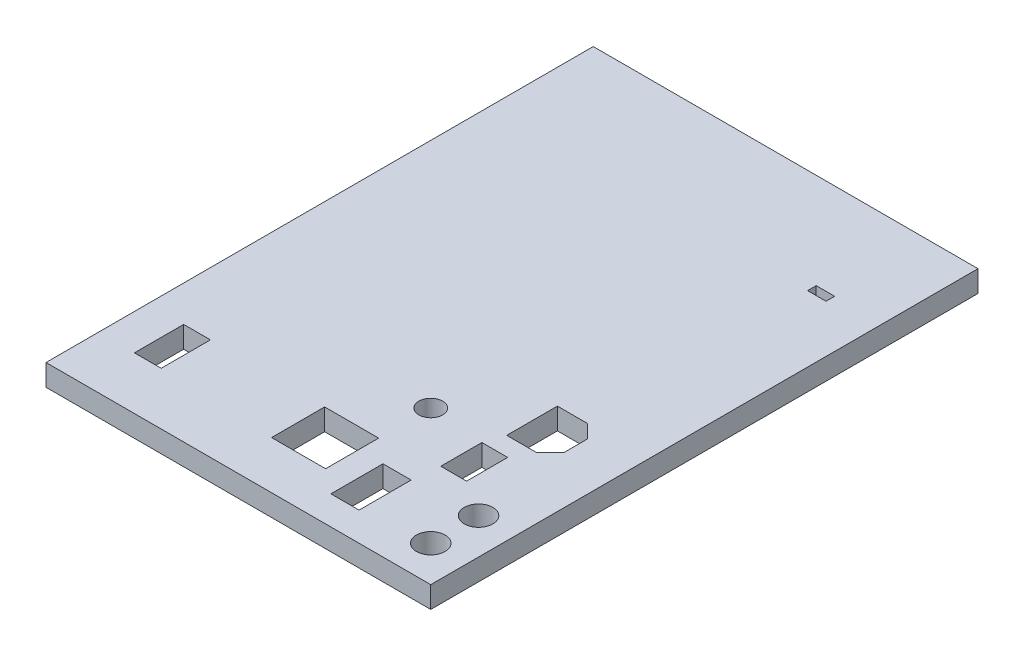
from build123d import *

# Parameters (mm, degrees)
SKETCH1_W           = 161
SKETCH1_H           = 229
BOSS_EXTRUDE1_DEPTH = 9
SKETCH2_R           = 5
SKETCH2_R_2         = 6
SKETCH2_W           = 11.8
SKETCH2_H           = 21.8
SKETCH2_W_2         = 22.6
SKETCH2_H_2         = 22.2
SKETCH2_W_3         = 11.2
SKETCH2_H_3         = 20.6
SKETCH2_W_4         = 7.7
SKETCH2_H_4         = 3.6
SKETCH2_W_5         = 10.8
SKETCH2_H_5         = 17.2
CUT_EXTRUDE1_DEPTH  = 141.255124684


with BuildPart() as part:
    # Sketch1 → Boss-Extrude1 (new body)
    with BuildSketch(Plane(origin=(0, 0, 0), x_dir=(1, 0, 0), z_dir=(0, 1, 0))):
        Rectangle(SKETCH1_W, SKETCH1_H)
    extrude(amount=BOSS_EXTRUDE1_DEPTH)

    # Sketch2 → Cut-Extrude1 (cut, through all)
    with BuildSketch(Plane(origin=(0, 9, 0), x_dir=(1, 0, 0), z_dir=(0, 1, 0))):
        with Locations((16.5, -50.5)):
            Circle(SKETCH2_R)
        with Locations((65.5, -99.5)):
            Circle(SKETCH2_R_2)
        with Locations((65.5, -79.5)):
            Circle(SKETCH2_R_2)
        with Locations((32.6, -91.6)):
            Rectangle(SKETCH2_W, SKETCH2_H)
        with Locations((5.2, -83.4)):
            Rectangle(SKETCH2_W_2, SKETCH2_H_2)
        with Locations((-59.9, -82.2)):
            Rectangle(SKETCH2_W_3, SKETCH2_H_3)
        Polygon((42.3, -23.3), (54.9, -23.3), (60.5, -28.9), (60.5, -38.9), (54.9, -44.5), (42.3, -44.5), align=None)
        with Locations((56.65, 72.7)):
            Rectangle(SKETCH2_W_4, SKETCH2_H_4)
        with Locations((45.1, -60.9)):
            Rectangle(SKETCH2_W_5, SKETCH2_H_5)
    extrude(amount=-CUT_EXTRUDE1_DEPTH, mode=Mode.SUBTRACT)


solid = part.part
